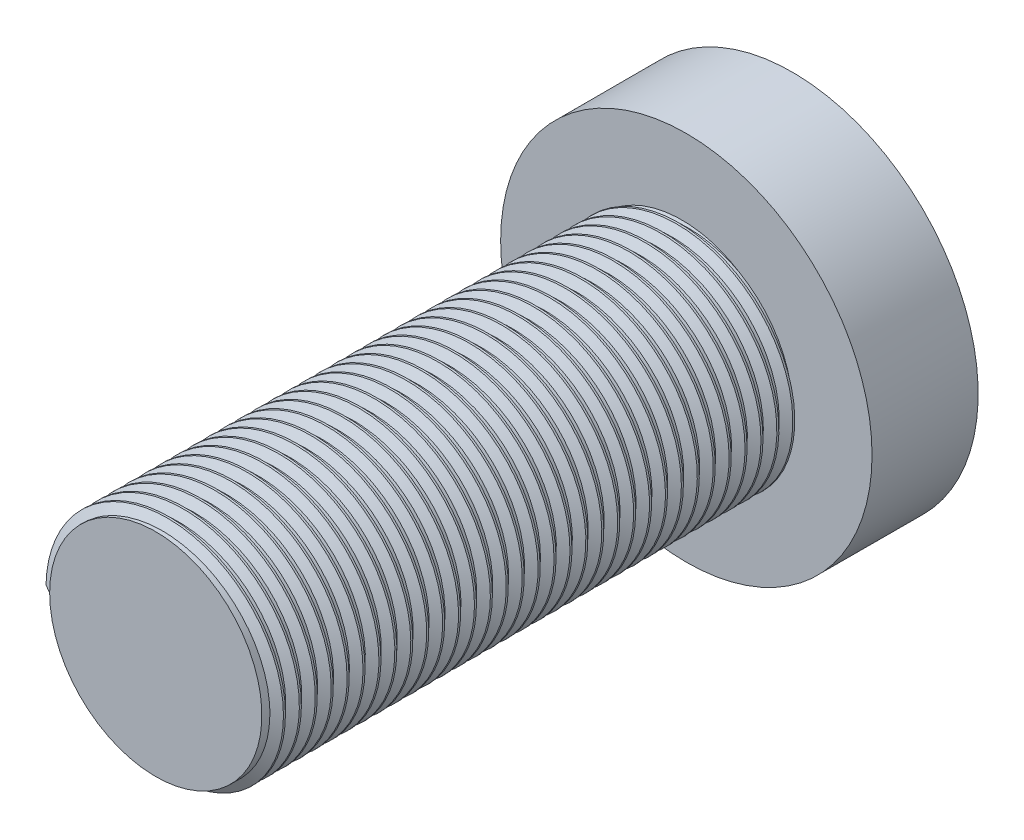
from build123d import *

# Parameters (mm, degrees)
SKETCH_1_R          = 3.5
EXTRUDE_1_DEPTH     = 1
SKETCH_2_R          = 2
EXTRUDE_2_DEPTH     = 10
EXTRUDE_START       = 1
SKETCH_3_R          = 3.5
EXTRUDE_3_DEPTH     = 1
THREAD_1_PITCH      = 0.3
SKETCH_8_W          = 1
SKETCH_8_H          = 4.5
CUT_EXTRUDE_1_DEPTH = 0.5


with BuildPart() as part:
    # Sketch 1 → 凸台-拉伸1 (new body)
    with BuildSketch(Plane.XY):
        Circle(SKETCH_1_R)
    extrude(amount=EXTRUDE_1_DEPTH)

    # 草图2 → 凸台-拉伸2 (add)
    with BuildSketch(Plane.XY.offset(1)):
        Circle(SKETCH_2_R)
    extrude(amount=EXTRUDE_2_DEPTH)

    # 草图3 → 凸台-拉伸3 (add)
    with BuildSketch(Plane(origin=(0, 0, 0), x_dir=(-1, 0, 0), z_dir=(0, 0, -1)).offset(EXTRUDE_START)):
        Circle(SKETCH_3_R)
    extrude(amount=-EXTRUDE_3_DEPTH)

    # 螺纹线1: the profile of Sketch 1 2 profile screwed along a right-hand helix of 33.333333 turns, 6 arcs to a turn; built about Z, then put on its axis
    thread_1_z = Axis((0, 0, 0), (0, 0, 1))
    thread_1_corners = [(1.9997, 0, -0.000173205), (2.162379763, 0, 0.09375), (2.162379763, 0, 0.13125), (1.9997, 0, 0.225173204)]
    with BuildLine(mode=Mode.PRIVATE) as thread_1_profile:
        Line(thread_1_corners[0], thread_1_corners[1])
        Line(thread_1_corners[1], thread_1_corners[2])
        Line(thread_1_corners[2], thread_1_corners[3])
        Line(thread_1_corners[3], thread_1_corners[0])
    thread_1_cap = Face(thread_1_profile.wire())
    thread_1_turn_angles = [0, 30, 60, 90, 120, 150, 180, 210, 240, 270, 300, 330, 360]
    thread_1_turn_weights = [1, 0.8660254037844387, 1, 0.8660254037844387, 1, 0.8660254037844387, 1, 0.8660254037844387, 1, 0.8660254037844387, 1, 0.8660254037844387, 1]
    thread_1_turn_rails = [Edge.make_bspline([Vector(p[0], p[1], 0).rotate(thread_1_z, thread_1_turn_angles[k]) / thread_1_turn_weights[k] + Vector(0, 0, p[2] + THREAD_1_PITCH * thread_1_turn_angles[k] / 360) for k in range(13)], [0, 0, 0, 1, 1, 2, 2, 3, 3, 4, 4, 5, 5, 6, 6, 6], 2, thread_1_turn_weights) for p in thread_1_corners]
    thread_1_turn_sides = [Face.make_surface_from_curves(thread_1_turn_rails[p[0]], thread_1_turn_rails[p[1]]) for p in [(0, 1), (1, 2), (2, 3), (3, 0)]]
    thread_1_last_angles = [11880, 11910, 11940, 11970, 12000]
    thread_1_last_weights = [1, 0.8660254037844387, 1, 0.8660254037844387, 1]
    thread_1_last_rails = [Edge.make_bspline([Vector(p[0], p[1], 0).rotate(thread_1_z, thread_1_last_angles[k]) / thread_1_last_weights[k] + Vector(0, 0, p[2] + THREAD_1_PITCH * thread_1_last_angles[k] / 360) for k in range(5)], [0, 0, 0, 1, 1, 2, 2, 2], 2, thread_1_last_weights) for p in thread_1_corners]
    thread_1_last_sides = [Face.make_surface_from_curves(thread_1_last_rails[p[0]], thread_1_last_rails[p[1]]) for p in [(0, 1), (1, 2), (2, 3), (3, 0)]]
    thread_1 = Plane(origin=(0, 0, 11), x_dir=(-1, 0, 0), z_dir=(0, 0, -1)) * Solid(Shell([*[p.moved(Location((0, 0, THREAD_1_PITCH * i))) for i in range(33) for p in thread_1_turn_sides], *thread_1_last_sides, thread_1_cap, thread_1_cap.rotate(thread_1_z, 12000).moved(Location((0, 0, THREAD_1_PITCH * 12000 / 360)))]))
    add(thread_1)

    # 草图8 → 切除-拉伸1 (cut)
    with BuildSketch(Plane(origin=(0, 0, -1), x_dir=(-1, 0, 0), z_dir=(0, 0, -1))):
        Rectangle(SKETCH_8_W, SKETCH_8_H)
    extrude(amount=-CUT_EXTRUDE_1_DEPTH, mode=Mode.SUBTRACT)


solid = part.part
